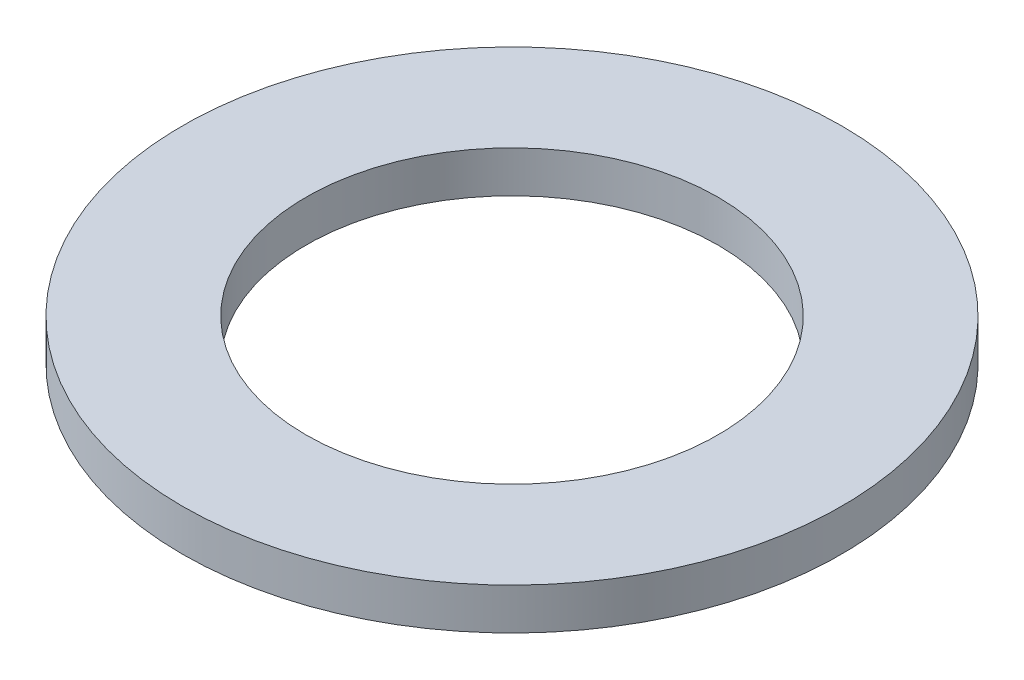
from build123d import *

# Parameters (mm, degrees)
SKETCH1_R           = 12.7
SKETCH1_R_2         = 7.9375
BOSS_EXTRUDE1_DEPTH = 0.8001


with BuildPart() as part:
    # Sketch1 → Boss-Extrude1 (new, symmetric)
    with BuildSketch(Plane(origin=(0, 0, 0), x_dir=(1, 0, 0), z_dir=(0, 1, 0))):
        Circle(SKETCH1_R)
        Circle(SKETCH1_R_2, mode=Mode.SUBTRACT)
    extrude(amount=BOSS_EXTRUDE1_DEPTH, both=True)


solid = part.part
